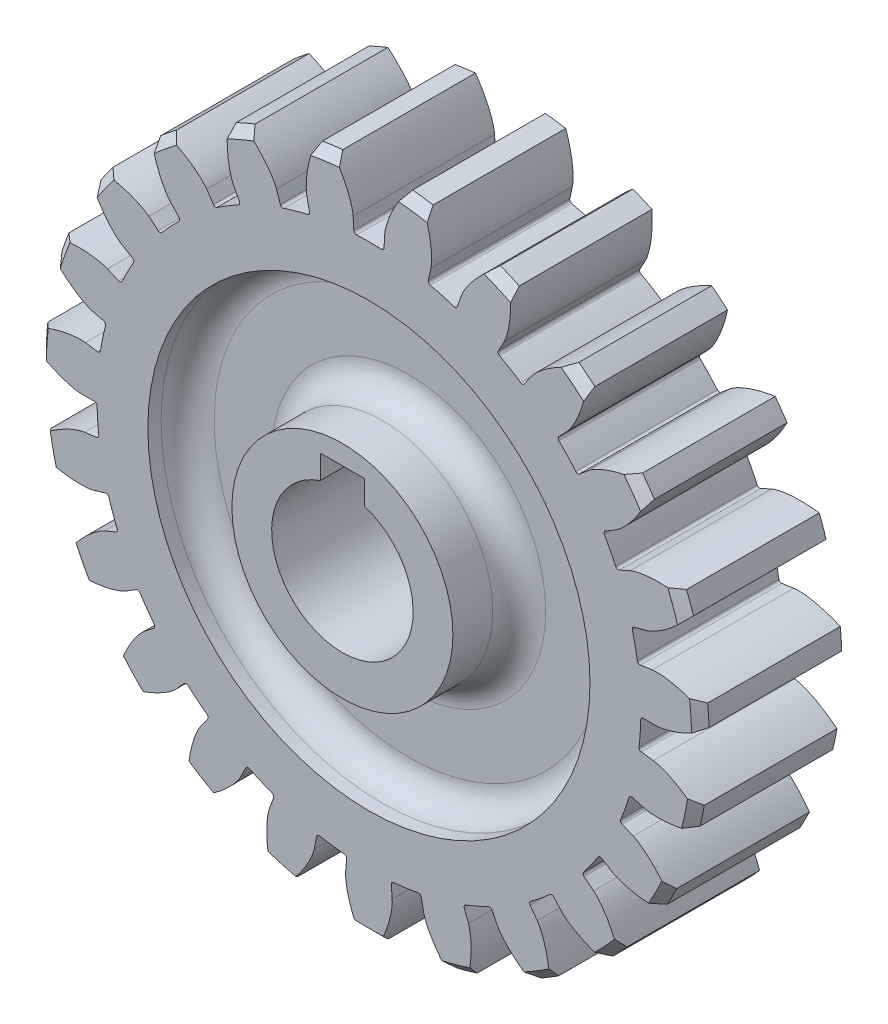
from build123d import *

# Parameters (mm, degrees)
SKETCH_1139_R                    = 37.5
EXTRUDE_1165_DEPTH               = 8
CHAMFER_1204_SIZE                = 1
CUT_EXTRUDE_1589_DEPTH           = 8
FILLET_2_R                       = 0.3
PATTERN_CIRCULAR_2_COUNT         = 23
FILLET_2_OF_PATTERN_CIRCULAR_2_R = 0.3
EXTRUDE_START                    = 3
SKETCH_1_R                       = 12.5
EXTRUDE_1_DEPTH                  = 20
CUT_EXTRUDE_1_DEPTH              = 57.661736235
SKETCH_3_R                       = 25
SKETCH_3_R_2                     = 12.5
CUT_EXTRUDE_2_DEPTH              = 4.5
FILLET_3_R                       = 3
FILLET_3_OF_MIRROR_1_R           = 3


with BuildPart() as part:
    # Sketch 1139 → Extrude 1165 (new, symmetric)
    with BuildSketch(Plane.XY):
        Circle(SKETCH_1139_R)
    extrude(amount=EXTRUDE_1165_DEPTH, both=True)

    # Chamfer 1204
    chamfer_1204_edges = [part.edges().sort_by_distance(p)[0] for p in [
        (-37.5, 0, 8),
    ]]
    chamfer(chamfer_1204_edges, length=CHAMFER_1204_SIZE)

    # Sketch 1274 → Cut-Extrude 1589 (cut, symmetric)
    with BuildSketch(Plane.XY):
        with BuildLine():
            ThreePointArc((-1.695010268, 30.70324804), (0, 30.75), (1.695010268, 30.70324804))
            Line((1.695010268, 30.70324804), (1.787031158, 32.370105327))
            add(Edge.make_bspline(
                [(1.787031158, 32.370105327), (1.788730613, 32.400889074), (1.793435333, 32.462341738), (1.808148502, 32.584785355), (1.848361627, 32.828120068), (1.919787041, 33.147430882), (2.030375155, 33.539747261), (2.212714287, 34.07818427), (2.437743603, 34.636508945), (2.711144983, 35.2233374), (3.107884488, 35.974214691), (3.45005155, 36.544863158), (3.728130515, 36.970484387), (3.927791233, 37.259918979), (3.949650837, 37.291423387)],
                knots=[0, 0, 0, 0, 0, 0.000700508, 0.001401017, 0.002802034, 0.005604068, 0.008132613, 0.010661158, 0.015718248, 0.019278665, 0.022839082, 0.029959916, 0.030831524, 0.030831524, 0.030831524, 0.030831524, 0.030831524], degree=4))
            ThreePointArc((3.949650837, 37.291423387), (0, 37.5), (-3.949650837, 37.291423387))
            add(Edge.make_bspline(
                [(-1.787031158, 32.370105327), (-1.788730613, 32.400889074), (-1.793435333, 32.462341738), (-1.808148502, 32.584785355), (-1.848361627, 32.828120068), (-1.919787041, 33.147430882), (-2.030375155, 33.539747261), (-2.212714287, 34.07818427), (-2.437743603, 34.636508945), (-2.711144983, 35.2233374), (-3.107884488, 35.974214691), (-3.45005155, 36.544863158), (-3.728130515, 36.970484387), (-3.927791233, 37.259918979), (-3.949650837, 37.291423387)],
                knots=[0, 0, 0, 0, 0, 0.000700508, 0.001401017, 0.002802034, 0.005604068, 0.008132613, 0.010661158, 0.015718248, 0.019278665, 0.022839082, 0.029959916, 0.030831524, 0.030831524, 0.030831524, 0.030831524, 0.030831524], degree=4))
            Line((-1.787031158, 32.370105327), (-1.695010268, 30.70324804))
        make_face()
    cut_extrude_1589 = extrude(amount=CUT_EXTRUDE_1589_DEPTH, both=True, mode=Mode.SUBTRACT)

    # 圆角2
    fillet_2_edges = [part.edges().sort_by_distance(p)[0] for p in [
        (1.695010268, 30.70324804, 0),
        (-1.695010268, 30.70324804, 0),
    ]]
    fillet(fillet_2_edges, radius=FILLET_2_R)

    # 圆周阵列2: Cut-Extrude 1589 ×23 about axis
    pattern_circular_2_axis = Axis((0, 0, 8), (0, 0, -1))
    for i in range(1, PATTERN_CIRCULAR_2_COUNT):
        add(cut_extrude_1589.rotate(pattern_circular_2_axis, i * 360 / PATTERN_CIRCULAR_2_COUNT), mode=Mode.SUBTRACT)

    # 圆角2 of 圆周阵列2
    fillet_2_of_pattern_circular_2_edges = [part.edges().sort_by_distance(p)[0] for p in [
        (9.915791875, 29.107380018, 0),
        (6.651482496, 30.021996613, 0),
        (17.401164559, 25.352750777, 0),
        (14.504665231, 27.114151038, 0),
        (23.595972474, 19.717823993, 0),
        (21.282103301, 22.19537292, 0),
        (28.040775054, 12.620516406, 0),
        (26.481145128, 15.63046553, 0),
        (30.405921627, 4.587202852, 0),
        (29.716201565, 7.906318016, 0),
        (30.516000091, -3.786322552, 0),
        (30.747343273, -0.404204936, 0),
        (28.362846429, -11.879033734, 0),
        (29.498095191, -8.684749858, 0),
        (24.106150199, -19.090731327, 0),
        (26.061108334, -16.321186612, 0),
        (18.061611087, -24.886556712, 0),
        (20.691288292, -22.74715562, 0),
        (10.677524907, -28.836660033, 0),
        (13.786890055, -27.486072157, 0),
        (2.501535551, -30.648080199, 0),
        (5.859981253, -30.186472462, 0),
        (-5.859981253, -30.186472462, 0),
        (-2.501535551, -30.648080199, 0),
        (-13.786890055, -27.486072157, 0),
        (-10.677524907, -28.836660033, 0),
        (-20.691288292, -22.74715562, 0),
        (-18.061611087, -24.886556712, 0),
        (-26.061108334, -16.321186612, 0),
        (-24.106150199, -19.090731327, 0),
        (-29.498095191, -8.684749858, 0),
        (-28.362846429, -11.879033734, 0),
        (-30.747343273, -0.404204936, 0),
        (-30.516000091, -3.786322552, 0),
        (-29.716201565, 7.906318016, 0),
        (-30.405921627, 4.587202852, 0),
        (-26.481145128, 15.63046553, 0),
        (-28.040775054, 12.620516406, 0),
        (-21.282103301, 22.19537292, 0),
        (-23.595972474, 19.717823993, 0),
        (-14.504665231, 27.114151038, 0),
        (-17.401164559, 25.352750777, 0),
        (-6.651482496, 30.021996613, 0),
        (-9.915791875, 29.107380018, 0),
    ]]
    fillet(fillet_2_of_pattern_circular_2_edges, radius=FILLET_2_OF_PATTERN_CIRCULAR_2_R)

    # 草图1 → 凸台-拉伸1 (add)
    with BuildSketch(Plane.XY.offset(8).offset(EXTRUDE_START)):
        Circle(SKETCH_1_R)
    extrude(amount=-EXTRUDE_1_DEPTH)

    # 草图2 → 切除-拉伸1 (cut, through all)
    with BuildSketch(Plane.XY.offset(11)):
        with BuildLine():
            Line((-2.5, 7.599342077), (-2.5, 10.3))
            Line((-2.5, 10.3), (2.5, 10.3))
            Line((2.5, 10.3), (2.5, 7.599342077))
            ThreePointArc((2.5, 7.599342077), (0, -8), (-2.5, 7.599342077))
        make_face()
    extrude(amount=-CUT_EXTRUDE_1_DEPTH, mode=Mode.SUBTRACT)

    # 草图3 → 切除-拉伸2 (cut)
    with BuildSketch(Plane.XY.offset(8)):
        Circle(SKETCH_3_R)
        Circle(SKETCH_3_R_2, mode=Mode.SUBTRACT)
    cut_extrude_2 = extrude(amount=-CUT_EXTRUDE_2_DEPTH, mode=Mode.SUBTRACT)

    # 圆角3
    fillet_3_edges = [part.edges().sort_by_distance(p)[0] for p in [
        (-25, 0, 3.5),
        (-12.5, 0, 3.5),
    ]]
    fillet(fillet_3_edges, radius=FILLET_3_R)

    # 镜向1: 切除-拉伸2 across plane
    add(cut_extrude_2.mirror(Plane.XY), mode=Mode.SUBTRACT)

    # 圆角3 of 镜向1
    fillet_3_of_mirror_1_edges = [part.edges().sort_by_distance(p)[0] for p in [
        (-25, 0, -3.5),
        (-12.5, 0, -3.5),
    ]]
    fillet(fillet_3_of_mirror_1_edges, radius=FILLET_3_OF_MIRROR_1_R)


solid = part.part
